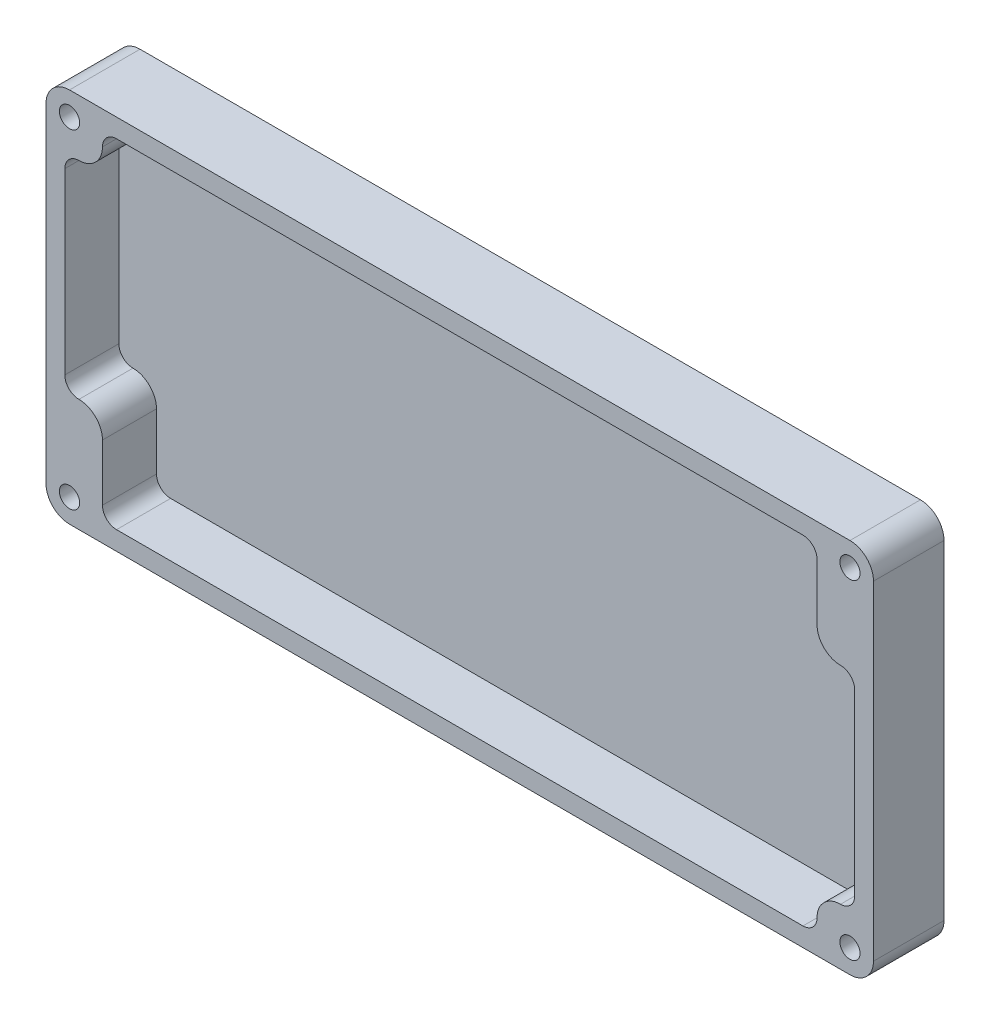
from build123d import *

# Parameters (mm, degrees)
SKETCH1_W                                   = 176
SKETCH1_H                                   = 80
BOSS_EXTRUDE1_DEPTH                         = 38.5
SKETCH2_W                                   = 168
SKETCH2_H                                   = 72
CUT_EXTRUDE1_DEPTH                          = 35
FILLET2_R                                   = 5
SKETCH8_W                                   = 8
SKETCH8_H                                   = 20
SKETCH8_H_2                                 = 8
BOSS_EXTRUDE2_DEPTH                         = 35
FILLET4_R                                   = 3
FILLET5_R                                   = 5
M4_TAPPED_HOLE1_D                           = 3.3
M4_TAPPED_HOLE1_DEPTH                       = 11.5
M4_TAPPED_HOLE1_TIP                         = 0.991420021
BOSS_EXTRUDE3_START                         = 1.5
BOSS_EXTRUDE3_DEPTH                         = 1.5
SKETCH25_W                                  = 192.92581759
SKETCH25_H                                  = 92.850065769
CUT_EXTRUDE4_DEPTH                          = 25
CBORE_FOR_M4_CHEESE_HEAD_SCREW2_D           = 4.3
CBORE_FOR_M4_CHEESE_HEAD_SCREW2_CBORE_D     = 8
CBORE_FOR_M4_CHEESE_HEAD_SCREW2_CBORE_DEPTH = 2.6


with BuildPart() as part:
    # Sketch1 → Boss-Extrude1 (new body)
    with BuildSketch(Plane.XY):
        Rectangle(SKETCH1_W, SKETCH1_H)
    extrude(amount=BOSS_EXTRUDE1_DEPTH)

    # Sketch2 → Cut-Extrude1 (cut)
    with BuildSketch(Plane.XY.offset(38.5)):
        Rectangle(SKETCH2_W, SKETCH2_H)
    extrude(amount=-CUT_EXTRUDE1_DEPTH, mode=Mode.SUBTRACT)

    # Fillet2
    fillet2_edges = [part.edges().sort_by_distance(p)[0] for p in [
        (-88, 40, 19.25),
        (88, 40, 19.25),
        (88, -40, 19.25),
        (-88, -40, 19.25),
    ]]
    fillet(fillet2_edges, radius=FILLET2_R)

    # Sketch8 → Boss-Extrude2 (add)
    with BuildSketch(Plane.XY.offset(3.5)):
        with Locations((80, 26)):
            Rectangle(SKETCH8_W, SKETCH8_H)
        with Locations((80, -32)):
            Rectangle(SKETCH8_W, SKETCH8_H_2)
        with Locations((-80, -26)):
            Rectangle(SKETCH8_W, SKETCH8_H)
        with Locations((-80, 32)):
            Rectangle(SKETCH8_W, SKETCH8_H_2)
    extrude(amount=BOSS_EXTRUDE2_DEPTH)

    # Fillet4
    fillet4_edges = [part.edges().sort_by_distance(p)[0] for p in [
        (76, 36, 21),
        (84, 16, 21),
        (84, -28, 21),
        (76, -36, 21),
        (-76, -36, 21),
        (-84, -16, 21),
        (-84, 28, 21),
        (-76, 36, 21),
    ]]
    fillet(fillet4_edges, radius=FILLET4_R)

    # Fillet5
    fillet5_edges = [part.edges().sort_by_distance(p)[0] for p in [
        (-76, -16, 21),
        (76, -28, 21),
        (76, 16, 21),
        (-76, 28, 21),
    ]]
    fillet(fillet5_edges, radius=FILLET5_R - 0.0001)  # a hair under: the kernel refuses the full size

    # M4 Tapped Hole1
    with Locations(Plane.XY.offset(38.5)):
        with Locations((-83, -35), (83, 35), (-83, 35), (83, -35)):
            Hole(M4_TAPPED_HOLE1_D / 2, depth=M4_TAPPED_HOLE1_DEPTH)
            with Locations((0, 0, -(M4_TAPPED_HOLE1_DEPTH + M4_TAPPED_HOLE1_TIP / 2))):  # 118° drill point
                Cone(0, M4_TAPPED_HOLE1_D / 2, M4_TAPPED_HOLE1_TIP, mode=Mode.SUBTRACT)

    # Sketch9 → Boss-Extrude3 (add)
    with BuildSketch(Plane.XY.offset(38.5).offset(BOSS_EXTRUDE3_START)):
        with BuildLine():
            Line((73, 37.5), (-73, 37.5))
            ThreePointArc((-73, 37.5), (-76.181980515, 36.181980515), (-77.5, 33))
            ThreePointArc((-77.5, 33), (-78.525126266, 30.525126266), (-81, 29.5))
            ThreePointArc((-81, 29.5), (-84.181980515, 28.181980515), (-85.5, 25))
            Line((-85.5, 25), (-85.5, -13))
            ThreePointArc((-85.5, -13), (-84.181980515, -16.181980515), (-81, -17.5))
            ThreePointArc((-81, -17.5), (-78.525126266, -18.525126266), (-77.5, -21))
            Line((-77.5, -21), (-77.5, -33))
            ThreePointArc((-77.5, -33), (-76.181980515, -36.181980515), (-73, -37.5))
            Line((-73, -37.5), (73, -37.5))
            ThreePointArc((73, -37.5), (76.181980515, -36.181980515), (77.5, -33))
            ThreePointArc((77.5, -33), (78.525126266, -30.525126266), (81, -29.5))
            ThreePointArc((81, -29.5), (84.181980515, -28.181980515), (85.5, -25))
            Line((85.5, -25), (85.5, 13))
            ThreePointArc((85.5, 13), (84.181980515, 16.181980515), (81, 17.5))
            ThreePointArc((81, 17.5), (78.525126266, 18.525126266), (77.5, 21))
            Line((77.5, 21), (77.5, 33))
            ThreePointArc((77.5, 33), (76.181980515, 36.181980515), (73, 37.5))
        make_face()
        with BuildLine():
            Line((73, 36), (-73, 36))
            ThreePointArc((-73, 36), (-75.121320344, 35.121320344), (-76, 33))
            ThreePointArc((-76, 33), (-77.464466094, 29.464466094), (-81, 28))
            ThreePointArc((-81, 28), (-83.121320344, 27.121320344), (-84, 25))
            Line((-84, 25), (-84, -13))
            ThreePointArc((-84, -13), (-83.121320344, -15.121320344), (-81, -16))
            ThreePointArc((-81, -16), (-77.464466094, -17.464466094), (-76, -21))
            Line((-76, -21), (-76, -33))
            ThreePointArc((-76, -33), (-75.121320344, -35.121320344), (-73, -36))
            Line((-73, -36), (73, -36))
            ThreePointArc((73, -36), (75.121320344, -35.121320344), (76, -33))
            ThreePointArc((76, -33), (77.464466094, -29.464466094), (81, -28))
            ThreePointArc((81, -28), (83.121320344, -27.121320344), (84, -25))
            Line((84, -25), (84, 13))
            ThreePointArc((84, 13), (83.121320344, 15.121320344), (81, 16))
            ThreePointArc((81, 16), (77.464466094, 17.464466094), (76, 21))
            Line((76, 21), (76, 33))
            ThreePointArc((76, 33), (75.121320344, 35.121320344), (73, 36))
        make_face(mode=Mode.SUBTRACT)
    extrude(amount=-BOSS_EXTRUDE3_DEPTH)

    # Sketch25 → Cut-Extrude4 (cut)
    with BuildSketch(Plane.XY.offset(40)):
        with Locations((-2.348347967, 1.083852907)):
            Rectangle(SKETCH25_W, SKETCH25_H)
    extrude(amount=-CUT_EXTRUDE4_DEPTH, mode=Mode.SUBTRACT)

    # CBORE for M4 Cheese Head Screw2 (through all)
    with Locations(Plane(origin=(0, 0, 0), x_dir=(-1, 0, 0), z_dir=(0, 0, -1))):
        with Locations((-83, 35), (83, 35), (83, -35), (-83, -35)):
            CounterBoreHole(CBORE_FOR_M4_CHEESE_HEAD_SCREW2_D / 2, CBORE_FOR_M4_CHEESE_HEAD_SCREW2_CBORE_D / 2, CBORE_FOR_M4_CHEESE_HEAD_SCREW2_CBORE_DEPTH)


solid = part.part
